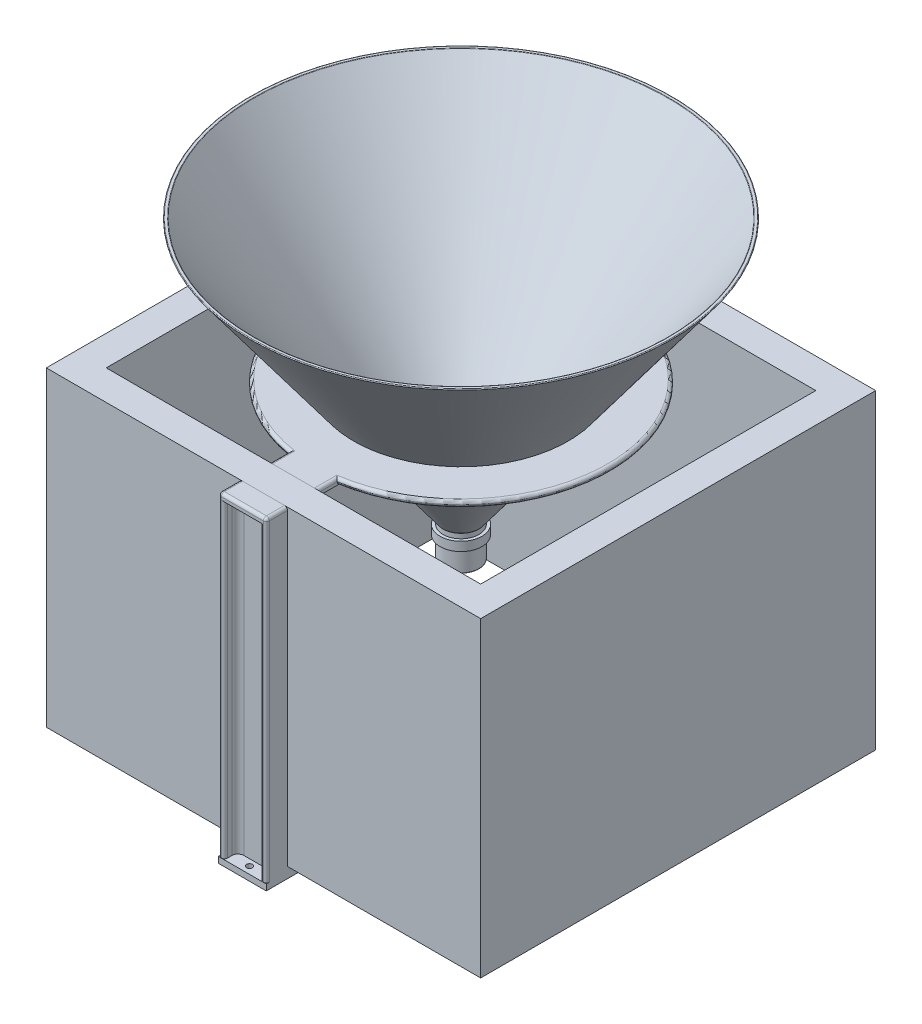
from build123d import *

# Parameters (mm, degrees)
FILLET1_R                 = 1
SKETCH8_R                 = 250
SKETCH8_R_2               = 179.21
BOSS_EXTRUDE2_DEPTH       = 10
SKETCH10_W                = 725.67
SKETCH10_H                = 660
SKETCH10_W_2              = 625.67
SKETCH10_H_2              = 560
BOSS_EXTRUDE3_DEPTH       = 520
BOSS_EXTRUDE10_DEPTH      = 400
BOSS_EXTRUDE10_DEPTH_BACK = 400
SKETCH22_W                = 80
SKETCH22_H                = 10
CUT_EXTRUDE10_DEPTH       = 10
SKETCH28_W                = 80
SKETCH28_H                = 34.81
CUT_EXTRUDE11_DEPTH       = 10
BOSS_EXTRUDE12_DEPTH      = 517.81
FILLET2_R                 = 5
FILLET3_R                 = 5
BOSS_EXTRUDE13_DEPTH      = 10
SKETCH31_R                = 5
CUT_EXTRUDE12_DEPTH       = 10
SKETCH33_R                = 35
SKETCH33_R_2              = 25
BOSS_EXTRUDE14_DEPTH      = 15
FILLET4_R                 = 5


with BuildPart() as part:
    # Sketch6 → Revolve2 (revolve)
    with BuildSketch(Plane.XY, mode=Mode.PRIVATE) as revolve2_sk:
        Polygon((321.283416485, 434.189617978), (327.503429332, 434.189617978), (5, -1.648752736), (5, -60), (0, -60), (0, 0), align=None)
    revolve(revolve2_sk.sketch.rotate(Axis((-25, 458.115236255, 0), (0, -1, 0)), 90), axis=Axis((-25, 458.115236255, 0), (0, -1, 0)))

    # Fillet1
    fillet1_edges = [part.edges().sort_by_distance(p)[0] for p in [
        (-25, 434.189617978, -352.503429332),
        (-25, -1.648752736, -30),
        (-25, -60, -30),
        (-25, -60, -25),
        (-25, 434.189617978, -346.283416485),
    ]]
    fillet(fillet1_edges, radius=FILLET1_R)


with BuildPart() as body_2:
    # Sketch8 → Boss-Extrude2 (new body)
    with BuildSketch(Plane(origin=(0, 200, 0), x_dir=(1, 0, 0), z_dir=(0, 1, 0))):
        with Locations(Location((-25, 0, 0), (0, 0, 270))):
            Circle(SKETCH8_R)
        with Locations(Location((-25, 0, 0), (0, 0, 270))):
            Circle(SKETCH8_R_2, mode=Mode.SUBTRACT)
    extrude(amount=-BOSS_EXTRUDE2_DEPTH)


with BuildPart() as body_3:
    # Sketch10 → Boss-Extrude3 (new body)
    with BuildSketch(Plane(origin=(0, 200, 0), x_dir=(1, 0, 0), z_dir=(0, 1, 0))):
        with Locations((-25, 0)):
            Rectangle(SKETCH10_W, SKETCH10_H)
        with Locations((-25, 0)):
            Rectangle(SKETCH10_W_2, SKETCH10_H_2, mode=Mode.SUBTRACT)
    extrude(amount=-BOSS_EXTRUDE3_DEPTH)


with BuildPart() as body_4:
    # Sketch22 → Boss-Extrude10 (new, two sides: drawn at the far end of the back side and taken through both)
    with BuildSketch(Plane.XY.offset(-BOSS_EXTRUDE10_DEPTH_BACK)):
        with Locations((-25, 195)):
            Rectangle(SKETCH22_W, SKETCH22_H)
    extrude(amount=BOSS_EXTRUDE10_DEPTH + BOSS_EXTRUDE10_DEPTH_BACK)


with BuildPart() as cut_extrude10_tool:
    # Sketch25 → Cut-Extrude10 (new body)
    with BuildSketch(Plane(origin=(0, 200, 0), x_dir=(1, 0, 0), z_dir=(0, 1, 0))):
        with BuildLine():
            Line((-65, 174.691220764), (-65, -174.691220764))
            ThreePointArc((-65, -174.691220764), (-25, -179.212227852), (15, -174.691220764))
            Line((15, -174.691220764), (15, 174.691220764))
            ThreePointArc((15, 174.691220764), (-25, 179.212227852), (-65, 174.691220764))
        make_face()
    extrude(amount=-CUT_EXTRUDE10_DEPTH)


with BuildPart() as body_2_1:
    add(body_2.part)

    # Cut-Extrude10: cut by cut_extrude10_tool
    add(cut_extrude10_tool.part, mode=Mode.SUBTRACT)


with BuildPart() as body_4_1:
    add(body_4.part)

    # Cut-Extrude10: cut by cut_extrude10_tool
    add(cut_extrude10_tool.part, mode=Mode.SUBTRACT)


with BuildPart() as body_2_2:
    add(body_2_1.part)

    # Combine3: read off the stored shape, not the designer's step
    # Combine3: union body 4
    add(body_4_1.part)

    # Sketch28 → Cut-Extrude11 (cut)
    with BuildSketch(Plane(origin=(0, 200, 0), x_dir=(1, 0, 0), z_dir=(0, 1, 0))):
        with Locations((-25, -382.595)):
            Rectangle(SKETCH28_W, SKETCH28_H)
        with Locations((-25, 382.595)):
            Rectangle(SKETCH28_W, SKETCH28_H)
    extrude(amount=-CUT_EXTRUDE11_DEPTH, mode=Mode.SUBTRACT)

    # Sketch29 → Boss-Extrude12 (add)
    with BuildSketch(Plane.XZ.offset(-190)):
        with BuildLine():
            Line((15, 365.19), (5, 365.19))
            Line((5, 365.19), (5, 352.69))
            ThreePointArc((5, 352.69), (2.071067812, 345.618932188), (-5, 342.69))
            Line((-5, 342.69), (-45, 342.69))
            ThreePointArc((-45, 342.69), (-52.071067812, 345.618932188), (-55, 352.69))
            Line((-55, 352.69), (-55, 365.19))
            Line((-55, 365.19), (-65, 365.19))
            Line((-65, 365.19), (-65, 310.19))
            Line((-65, 310.19), (-55, 310.19))
            Line((-55, 310.19), (-55, 322.69))
            ThreePointArc((-55, 322.69), (-52.071067812, 329.761067812), (-45, 332.69))
            Line((-45, 332.69), (-5, 332.69))
            ThreePointArc((-5, 332.69), (2.071067812, 329.761067812), (5, 322.69))
            Line((5, 322.69), (5, 310.19))
            Line((5, 310.19), (15, 310.19))
            Line((15, 310.19), (15, 365.19))
        make_face()
        with BuildLine():
            Line((-55, -365.19), (-65, -365.19))
            Line((-65, -365.19), (-65, -310.19))
            Line((-65, -310.19), (-55, -310.19))
            Line((-55, -310.19), (-55, -322.69))
            ThreePointArc((-55, -322.69), (-52.071067812, -329.761067812), (-45, -332.69))
            Line((-45, -332.69), (-5, -332.69))
            ThreePointArc((-5, -332.69), (2.071067812, -329.761067812), (5, -322.69))
            Line((5, -322.69), (5, -310.19))
            Line((5, -310.19), (15, -310.19))
            Line((15, -310.19), (15, -365.19))
            Line((15, -365.19), (5, -365.19))
            Line((5, -365.19), (5, -352.69))
            ThreePointArc((5, -352.69), (2.071067812, -345.618932188), (-5, -342.69))
            Line((-5, -342.69), (-45, -342.69))
            ThreePointArc((-45, -342.69), (-52.071067812, -345.618932188), (-55, -352.69))
            Line((-55, -352.69), (-55, -365.19))
        make_face()
    extrude(amount=BOSS_EXTRUDE12_DEPTH)

    # Fillet2
    fillet2_edges = [body_2_2.edges().sort_by_distance(p)[0] for p in [
        (-65, -68.905, 310.19),
        (-55, -68.905, 310.19),
        (5, -68.905, 310.19),
        (15, -68.905, 310.19),
        (15, -63.905, 365.19),
        (5, -68.905, 365.19),
        (-55, -68.905, 365.19),
        (-65, -63.905, 365.19),
    ]]
    fillet(fillet2_edges, radius=FILLET2_R - 0.0001)  # a hair under: the kernel refuses the full size

    # Fillet3
    fillet3_edges = [body_2_2.edges().sort_by_distance(p)[0] for p in [
        (15, -68.905, -310.19),
        (5, -68.905, -310.19),
        (-55, -68.905, -310.19),
        (-65, -68.905, -310.19),
        (-65, -63.905, -365.19),
        (-55, -68.905, -365.19),
        (5, -68.905, -365.19),
        (15, -63.905, -365.19),
    ]]
    fillet(fillet3_edges, radius=FILLET3_R - 0.0001)  # a hair under: the kernel refuses the full size

    # Sketch30 → Boss-Extrude13 (add)
    with BuildSketch(Plane.XZ.offset(327.81)):
        Polygon((15, 360.19), (15, 365.34), (-65, 365.34), (-65, 315.19), (-65, 310.04), (15, 310.04), (15, 315.19), align=None)
        Polygon((15, -360.19), (15, -365.34), (-65, -365.34), (-65, -315.19), (-65, -310.04), (15, -310.04), (15, -315.19), align=None)
    extrude(amount=BOSS_EXTRUDE13_DEPTH)

    # Sketch31 → Cut-Extrude12 (cut)
    with BuildSketch(Plane(origin=(0, -327.81, 0), x_dir=(1, 0, 0), z_dir=(0, 1, 0))):
        with Locations(Location((-25, -353.34, 0), (0, 0, 270))):
            Circle(SKETCH31_R)
        with Locations(Location((-25, -322.04, 0), (0, 0, 270))):
            Circle(SKETCH31_R)
    cut_extrude12 = extrude(amount=-CUT_EXTRUDE12_DEPTH, mode=Mode.SUBTRACT)

    # Mirror1: Cut-Extrude12 across plane
    add(cut_extrude12.mirror(Plane.XY), mode=Mode.SUBTRACT)

    # Fillet4
    fillet4_edges = [body_2_2.edges().sort_by_distance(p)[0] for p in [
        (13.535563195, 200, -363.725563195),
        (15, 200, -303.484676793),
        (225, 200, 0),
        (15, 200, 303.484676793),
        (13.535563195, 200, 363.725563195),
        (-25, 200, 365.19),
        (-63.535563195, 200, 363.725563195),
        (-65, 200, 303.484676793),
        (-275, 200, 0),
        (-65, 200, -303.484676793),
        (-63.535563195, 200, -363.725563195),
        (-25, 200, -365.19),
        (-275, 190, 0),
        (225, 190, 0),
    ]]
    fillet(fillet4_edges, radius=FILLET4_R - 0.0001)  # a hair under: the kernel refuses the full size


with BuildPart() as body_4_2:
    # Sketch33 → Boss-Extrude14 (new body)
    with BuildSketch(Plane(origin=(0, -9.73, 0), x_dir=(1, 0, 0), z_dir=(0, 1, 0))):
        with Locations(Location((-25, 0, 0), (0, 0, 270))):
            Circle(SKETCH33_R)
        with Locations(Location((-25, 0, 0), (0, 0, 270))):
            Circle(SKETCH33_R_2, mode=Mode.SUBTRACT)
    extrude(amount=-BOSS_EXTRUDE14_DEPTH)


solid = Compound([part.part, body_3.part, body_2_2.part, body_4_2.part])
